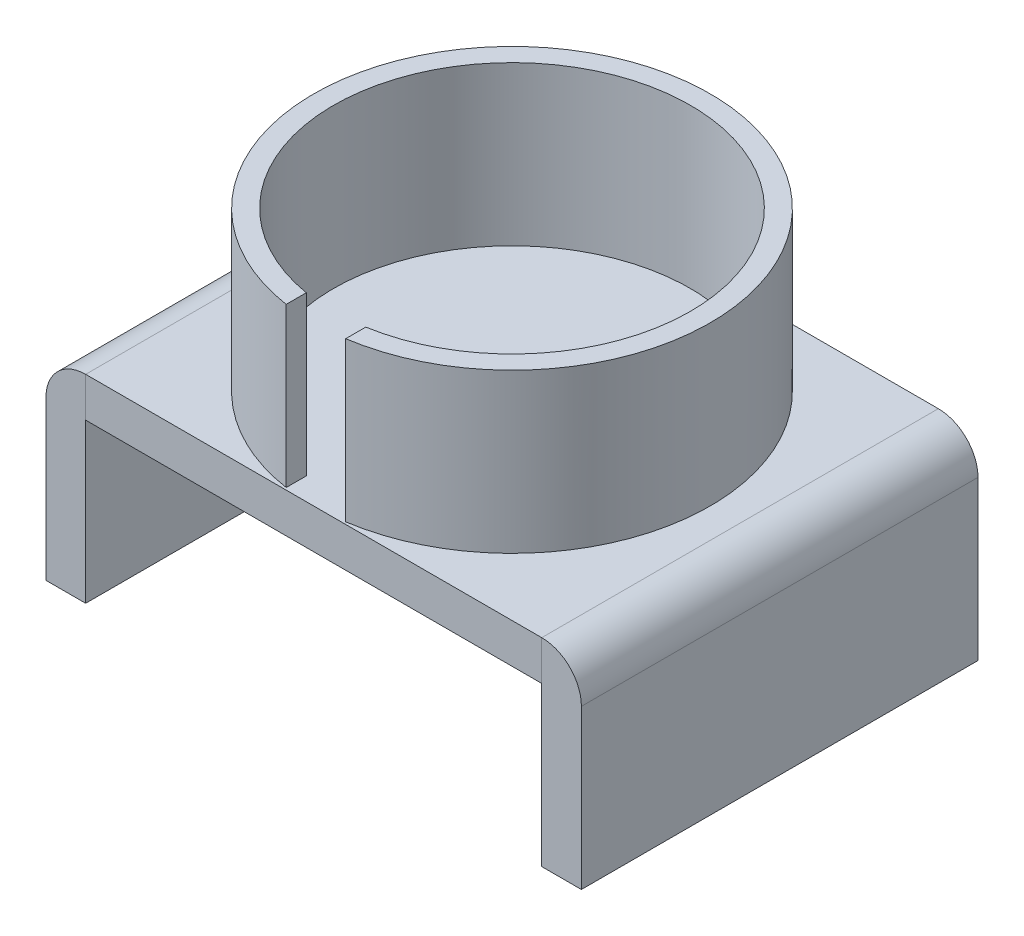
from build123d import *

# Parameters (mm, degrees)
SOCLE_W                                        = 115
SOCLE_H                                        = 100
EXTRUSION_DU_SOCLE_DEPTH                       = 10
EXTRUSION_DES_FIXATIONS_LAT_RALES_DEPTH        = 40
EXTRUSION_DES_FIXATIONS_LAT_RALES_DEPTH_BACK   = 10
FIXATIONS_LAT_RALES_W                          = 10
FIXATIONS_LAT_RALES_H                          = 100
EXTRUSION_DES_FIXATIONS_LAT_RALES_2_DEPTH      = 40
EXTRUSION_DES_FIXATIONS_LAT_RALES_2_DEPTH_BACK = 10
CONG_FIXATION_GAUCHE_R                         = 10
CONG_FIXATION_DROITE_R                         = 10
EXTRUSION_FIXATION_TASSE_DEPTH                 = 40


with BuildPart() as part:
    # socle → extrusion du socle (new body)
    with BuildSketch(Plane(origin=(0, 0, 0), x_dir=(1, 0, 0), z_dir=(0, 1, 0))):
        with Locations((-0.807962529, 12.295081967)):
            Rectangle(SOCLE_W, SOCLE_H)
    extrude(amount=EXTRUSION_DU_SOCLE_DEPTH)

    # socle tasse → extrusion fixation tasse (add)
    with BuildSketch(Plane(origin=(0, 10, 0), x_dir=(1, 0, 0), z_dir=(0, 1, 0))):
        with BuildLine():
            ThreePointArc((6.692037471, -37.139217866), (-0.807962529, 62.295081967), (-8.307962529, -37.139217866))
            Line((-8.307962529, -37.139217866), (-8.307962529, -32.075516406))
            ThreePointArc((-8.307962529, -32.075516406), (-0.807962529, 57.295081967), (6.692037471, -32.075516406))
            Line((6.692037471, -32.075516406), (6.692037471, -37.139217866))
        make_face()
    extrude(amount=EXTRUSION_FIXATION_TASSE_DEPTH)


with BuildPart() as body_2:
    # fixations latérales → extrusion des fixations latérales (new, two sides: drawn at the far end of the back side and taken through both)
    with BuildSketch(Plane.XZ.offset(-EXTRUSION_DES_FIXATIONS_LAT_RALES_DEPTH_BACK)):
        with Locations((-63.307962529, -12.295081967)):
            Rectangle(FIXATIONS_LAT_RALES_W, FIXATIONS_LAT_RALES_H)
    extrude(amount=EXTRUSION_DES_FIXATIONS_LAT_RALES_DEPTH + EXTRUSION_DES_FIXATIONS_LAT_RALES_DEPTH_BACK)

    # congé fixation gauche
    cong_fixation_gauche_edges = [body_2.edges().sort_by_distance(p)[0] for p in [
        (-68.307962529, 10, -12.295081967),
    ]]
    fillet(cong_fixation_gauche_edges, radius=CONG_FIXATION_GAUCHE_R - 0.0001)  # a hair under: the kernel refuses the full size


with BuildPart() as body_3:
    # fixations latérales → extrusion des fixations lat_rales 2 (new, two sides: drawn at the far end of the back side and taken through both)
    with BuildSketch(Plane.XZ.offset(-EXTRUSION_DES_FIXATIONS_LAT_RALES_2_DEPTH_BACK)):
        with Locations((61.692037471, -12.295081967)):
            Rectangle(FIXATIONS_LAT_RALES_W, FIXATIONS_LAT_RALES_H)
    extrude(amount=EXTRUSION_DES_FIXATIONS_LAT_RALES_2_DEPTH + EXTRUSION_DES_FIXATIONS_LAT_RALES_2_DEPTH_BACK)

    # congé fixation droite
    cong_fixation_droite_edges = [body_3.edges().sort_by_distance(p)[0] for p in [
        (66.692037471, 10, -12.295081967),
    ]]
    fillet(cong_fixation_droite_edges, radius=CONG_FIXATION_DROITE_R - 0.0001)  # a hair under: the kernel refuses the full size


solid = Compound([part.part, body_2.part, body_3.part])
